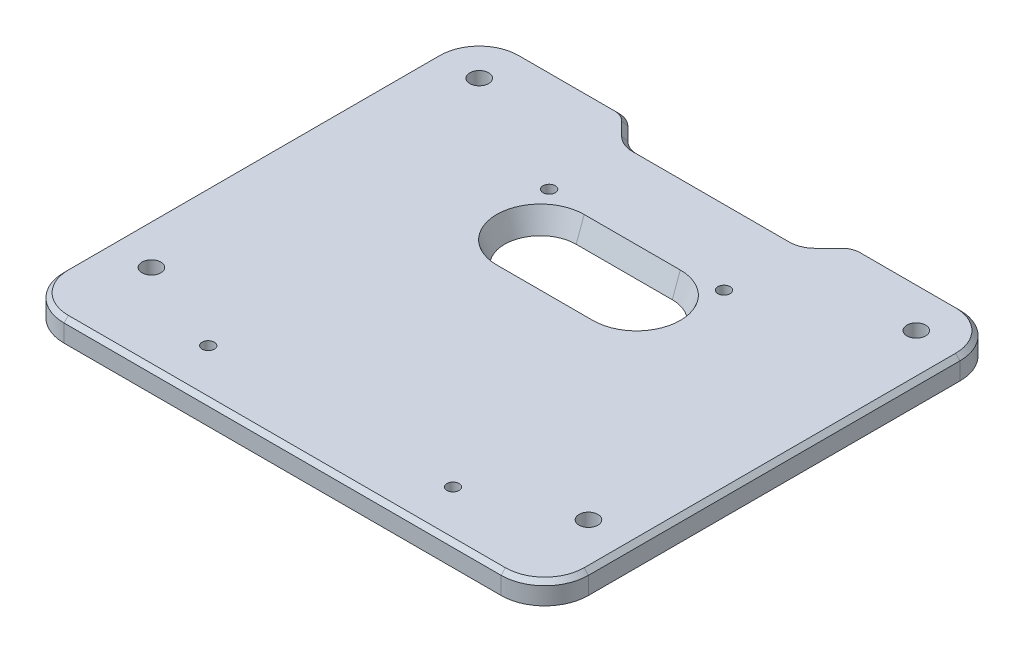
from build123d import *

# Parameters (mm, degrees)
SKETCH2_W           = 120
SKETCH2_H           = 105
SKETCH2_R           = 1.4
BOSS_EXTRUDE2_DEPTH = 5
CUT_EXTRUDE13_DEPTH = 90.336442732
FILLET6_R           = 5
FILLET5_R           = 10
CHAMFER4_SIZE       = 1
SKETCH11_R          = 2.15
CUT_EXTRUDE10_DEPTH = 90.336442732
SKETCH13_R          = 3.25
CUT_EXTRUDE12_DEPTH = 2.5
CUT_EXTRUDE14_DEPTH = 90.336442732
CHAMFER5_SIZE       = 3
CHAMFER5_SIZE_2     = 8.242432258


with BuildPart() as part:
    # Sketch2 → Boss-Extrude2 (new body)
    with BuildSketch(Plane(origin=(0, 0, 0), x_dir=(1, 0, 0), z_dir=(0, 1, 0))):
        with Locations((0, 13.5)):
            Rectangle(SKETCH2_W, SKETCH2_H)
        with Locations(Location((-28, -28, 0), (0, 0, 270))):
            Circle(SKETCH2_R, mode=Mode.SUBTRACT)
        with Locations(Location((28, -28, 0), (0, 0, 270))):
            Circle(SKETCH2_R, mode=Mode.SUBTRACT)
        with Locations(Location((20, 42, 0), (0, 0, 270))):
            Circle(SKETCH2_R, mode=Mode.SUBTRACT)
        with Locations(Location((-20, 42, 0), (0, 0, 270))):
            Circle(SKETCH2_R, mode=Mode.SUBTRACT)
    extrude(amount=BOSS_EXTRUDE2_DEPTH)

    # Sketch9 → Cut-Extrude13 (cut, through all)
    with BuildSketch(Plane(origin=(0, 5, 0), x_dir=(1, 0, 0), z_dir=(0, 1, 0))):
        Polygon((-26, 66), (-20, 60), (20, 60), (26, 66), align=None)
    extrude(amount=-CUT_EXTRUDE13_DEPTH, mode=Mode.SUBTRACT)

    # Fillet6
    fillet6_edges = [part.edges().sort_by_distance(p)[0] for p in [
        (-26, 2.5, -66),
        (26, 2.5, -66),
        (20, 2.5, -60),
        (-20, 2.5, -60),
    ]]
    fillet(fillet6_edges, radius=FILLET6_R)

    # Fillet5
    fillet5_edges = [part.edges().sort_by_distance(p)[0] for p in [
        (-60, 2.5, -66),
        (60, 2.5, -66),
        (60, 2.5, 39),
        (-60, 2.5, 39),
    ]]
    fillet(fillet5_edges, radius=FILLET5_R)

    # Chamfer4
    chamfer4_edges = [part.edges().sort_by_distance(p)[0] for p in [
        (23, 5, -63),
        (0, 5, -60),
        (-23, 5, -63),
        (-39.035533906, 5, -66),
        (-26.15765065, 5, -65.619397663),
        (26.15765065, 5, -65.619397663),
        (19.84234935, 5, -60.380602337),
        (-19.84234935, 5, -60.380602337),
        (-60, 5, -13.5),
        (39.035533906, 5, -66),
        (0, 5, 39),
        (60, 5, -13.5),
        (-57.071067812, 5, 36.071067812),
        (57.071067812, 5, 36.071067812),
        (57.071067812, 5, -63.071067812),
        (-57.071067812, 5, -63.071067812),
    ]]
    chamfer(chamfer4_edges, length=CHAMFER4_SIZE)

    # Sketch11 → Cut-Extrude10 (cut, through all)
    with BuildSketch(Plane(origin=(0, 5, 0), x_dir=(1, 0, 0), z_dir=(0, 1, 0))):
        with Locations(Location((-50, 56, 0), (0, 0, 270))):
            Circle(SKETCH11_R)
        with Locations(Location((50, 56, 0), (0, 0, 270))):
            Circle(SKETCH11_R)
        with Locations(Location((-50, -19, 0), (0, 0, 270))):
            Circle(SKETCH11_R)
        with Locations(Location((50, -19, 0), (0, 0, 270))):
            Circle(SKETCH11_R)
    extrude(amount=-CUT_EXTRUDE10_DEPTH, mode=Mode.SUBTRACT)

    # Sketch13 → Cut-Extrude12 (cut)
    with BuildSketch(Plane.XZ):
        with Locations(Location((-28, 28, 0), (0, 0, 270))):
            Circle(SKETCH13_R)
        with Locations(Location((28, 28, 0), (0, 0, 270))):
            Circle(SKETCH13_R)
        with Locations(Location((-20, -42, 0), (0, 0, 270))):
            Circle(SKETCH13_R)
        with Locations(Location((20, -42, 0), (0, 0, 270))):
            Circle(SKETCH13_R)
    extrude(amount=-CUT_EXTRUDE12_DEPTH, mode=Mode.SUBTRACT)

    # Sketch14 → Cut-Extrude14 (cut, through all)
    with BuildSketch(Plane(origin=(0, 5, 0), x_dir=(1, 0, 0), z_dir=(0, 1, 0))):
        with BuildLine():
            Line((-11, 38), (11, 38))
            ThreePointArc((11, 38), (18, 31), (11, 24))
            Line((11, 24), (-11, 24))
            ThreePointArc((-11, 24), (-18, 31), (-11, 38))
        make_face()
    extrude(amount=-CUT_EXTRUDE14_DEPTH, mode=Mode.SUBTRACT)

    # Chamfer5
    # the kernel refuses this chamfer: 8.242432258, 3 mm, written as the material it takes off along each edge
    with BuildSketch(Plane(origin=(11, 5, -24), x_dir=(0, 0.09904090225205062, 0.9950833631817486), z_dir=(-1, 0, 0)), Plane(origin=(-11, 5, -38), x_dir=(0, 0.09904090225205073, -0.9950833631817486), z_dir=(1, 0, 0))) as chamfer5_piece_1:
        Polygon((CHAMFER5_SIZE * 0.995083363182, -CHAMFER5_SIZE * 0.0990409022521), (-CHAMFER5_SIZE_2 * 0.0990409022564, -CHAMFER5_SIZE_2 * 0.995083363226), (0, 0), align=None)
    extrude(amount=22, mode=Mode.SUBTRACT)
    with BuildSketch(Plane(origin=(11, 5, -31), x_dir=(0, 0, -1), z_dir=(-1, 0, 0))) as chamfer5_piece_2:
        Polygon((7 + CHAMFER5_SIZE, 0), (7, CHAMFER5_SIZE_2), (7, 0), align=None)
    revolve(axis=Axis((11, 5, -31), (0, -1, 0)), revolution_arc=180, mode=Mode.SUBTRACT)
    with BuildSketch(Plane(origin=(-11, 5, -31), x_dir=(0, 0, 1), z_dir=(1, 0, 0))) as chamfer5_piece_3:
        Polygon((7 + CHAMFER5_SIZE, 0), (7, CHAMFER5_SIZE_2), (7, 0), align=None)
    revolve(axis=Axis((-11, 5, -31), (0, -1, 0)), revolution_arc=180, mode=Mode.SUBTRACT)


solid = part.part
